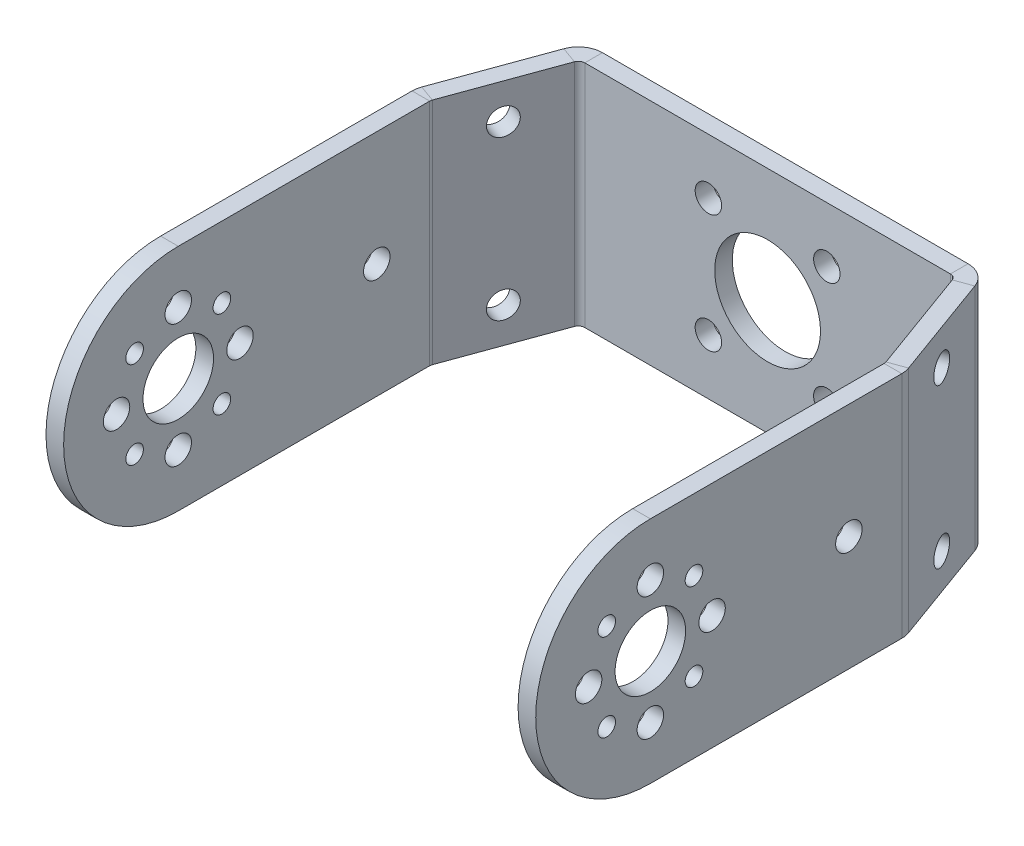
from build123d import *

# Parameters (mm, degrees)
SKETCH_1_W                       = 42.5
SKETCH_1_H                       = 26
SM_BASE_FLANGE_1_DEPTH           = 2
SM_EDGE_FLANGE_1_STRIP_CUT_DEPTH = 26
SM_EDGE_FLANGE_1_DEPTH           = 26
SM_EDGE_FLANGE_2_STRIP_CUT_DEPTH = 26
SM_EDGE_FLANGE_2_DEPTH           = 26
SM_EDGE_FLANGE_3_STRIP_CUT_DEPTH = 26
SM_EDGE_FLANGE_3_DEPTH           = 26
SM_EDGE_FLANGE_4_STRIP_CUT_DEPTH = 26
SM_EDGE_FLANGE_4_DEPTH           = 26
CUT_EXTRUDE_1_DEPTH              = 100
SKETCH_19_R                      = 1
SKETCH_19_R_2                    = 1.5
SKETCH_19_R_3                    = 4
CUT_EXTRUDE_2_DEPTH              = 100
SKETCH_20_R                      = 6
SKETCH_20_R_2                    = 1.5
CUT_EXTRUDE_3_DEPTH              = 100
SKETCH_21_R                      = 1.5
CUT_EXTRUDE_4_DEPTH              = 2
SKETCH_22_R                      = 1.5
CUT_EXTRUDE_5_DEPTH              = 2
SKETCH_23_R                      = 1.5
CUT_EXTRUDE_6_DEPTH              = 100


# Sheet-metal steps are written as plain solids
with BuildPart() as part:
    # Sketch 1 → 基体-法兰1 (new body)
    with BuildSketch(Plane.XY):
        with Locations((2.752259036, 2.278990964)):
            Rectangle(SKETCH_1_W, SKETCH_1_H)
    extrude(amount=-SM_BASE_FLANGE_1_DEPTH)

    # 边线-法兰1 strip (across the edge) → 边线-法兰1 strip cut (cut)
    with BuildSketch(Plane(origin=(24.002259036, -10.721009036, 0), x_dir=(-0.939692620785907, 0, 0.3420201433256726), z_dir=(0, 1, 0))):
        Polygon((-9.101268459, 1.184235268), (-0.199372324, -2.055789953), (0.484667962, -0.176404712), (-8.417228173, 3.06362051), align=None)
    extrude(amount=SM_EDGE_FLANGE_1_STRIP_CUT_DEPTH, mode=Mode.SUBTRACT)

    # 边线-法兰1 section (across the edge) → 边线-法兰1 (add)
    with BuildSketch(Plane(origin=(24.002259036, -10.721009036, 0), x_dir=(-0.939692620785907, 0, 0.3420201433256726), z_dir=(0, 1, 0))):
        with BuildLine():
            Line((-2, 0.515772873), (-2, 13.219584924))
            Line((-2, 13.219584924), (0, 13.219584924))
            Line((0, 13.219584924), (0, 0.515772873))
            ThreePointArc((0, 0.515772873), (0.133212604, 0.09327647), (0.484667962, -0.176404712))
            Line((0.484667962, -0.176404712), (-0.199372324, -2.055789953))
            ThreePointArc((-0.199372324, -2.055789953), (-1.505091484, -1.053876403), (-2, 0.515772873))
        make_face()
    extrude(amount=SM_EDGE_FLANGE_1_DEPTH)

    # 边线-法兰2 strip (across the edge) → 边线-法兰2 strip cut (cut)
    with BuildSketch(Plane(origin=(28.523623366, -10.721009036, 12.422346403), x_dir=(-1, 0, 0), z_dir=(0, 1, 0))):
        Polygon((-5.074988048, 8.095806265), (-1.834962826, -0.80608987), (0.044422416, -0.122049584), (-3.195602806, 8.779846552), align=None)
    extrude(amount=SM_EDGE_FLANGE_2_STRIP_CUT_DEPTH, mode=Mode.SUBTRACT)

    # 边线-法兰2 section (across the edge) → 边线-法兰2 (add)
    with BuildSketch(Plane(origin=(28.523623366, -10.721009036, 12.422346403), x_dir=(-1, 0, 0), z_dir=(0, 1, 0))):
        with BuildLine():
            Line((-2, 0.129882454), (-2, 41.647346039))
            Line((-2, 41.647346039), (0, 41.647346039))
            Line((0, 41.647346039), (0, 0.129882454))
            ThreePointArc((0, 0.129882454), (0.011190609, 0.001973206), (0.044422416, -0.122049584))
            Line((0.044422416, -0.122049584), (-1.834962826, -0.80608987))
            ThreePointArc((-1.834962826, -0.80608987), (-1.958424897, -0.345323149), (-2, 0.129882454))
        make_face()
    extrude(amount=SM_EDGE_FLANGE_2_DEPTH)

    # 边线-法兰3 strip (across the edge) → 边线-法兰3 strip cut (cut)
    with BuildSketch(Plane(origin=(-18.497740964, 15.278990964, 0), x_dir=(0.939692620785907, 0, 0.3420201433256726), z_dir=(0, -1, 0))):
        Polygon((-9.101268459, 1.184235268), (-0.199372324, -2.055789953), (0.484667962, -0.176404712), (-8.417228173, 3.06362051), align=None)
    extrude(amount=SM_EDGE_FLANGE_3_STRIP_CUT_DEPTH, mode=Mode.SUBTRACT)

    # 边线-法兰3 section (across the edge) → 边线-法兰3 (add)
    with BuildSketch(Plane(origin=(-18.497740964, 15.278990964, 0), x_dir=(0.939692620785907, 0, 0.3420201433256726), z_dir=(0, -1, 0))):
        with BuildLine():
            Line((-2, 0.515772873), (-2, 13.219584924))
            Line((-2, 13.219584924), (0, 13.219584924))
            Line((0, 13.219584924), (0, 0.515772873))
            ThreePointArc((0, 0.515772873), (0.133212604, 0.09327647), (0.484667962, -0.176404712))
            Line((0.484667962, -0.176404712), (-0.199372324, -2.055789953))
            ThreePointArc((-0.199372324, -2.055789953), (-1.505091484, -1.053876403), (-2, 0.515772873))
        make_face()
    extrude(amount=SM_EDGE_FLANGE_3_DEPTH)

    # 边线-法兰4 strip (across the edge) → 边线-法兰4 strip cut (cut)
    with BuildSketch(Plane(origin=(-23.019105294, 15.278990964, 12.422346403), x_dir=(1, 0, 0), z_dir=(0, -1, 0))):
        Polygon((-5.074988048, 8.095806265), (-1.834962826, -0.80608987), (0.044422416, -0.122049584), (-3.195602806, 8.779846552), align=None)
    extrude(amount=SM_EDGE_FLANGE_4_STRIP_CUT_DEPTH, mode=Mode.SUBTRACT)

    # 边线-法兰4 section (across the edge) → 边线-法兰4 (add)
    with BuildSketch(Plane(origin=(-23.019105294, 15.278990964, 12.422346403), x_dir=(1, 0, 0), z_dir=(0, -1, 0))):
        with BuildLine():
            Line((-2, 0.129882454), (-2, 41.647346039))
            Line((-2, 41.647346039), (0, 41.647346039))
            Line((0, 41.647346039), (0, 0.129882454))
            ThreePointArc((0, 0.129882454), (0.011190609, 0.001973206), (0.044422416, -0.122049584))
            Line((0.044422416, -0.122049584), (-1.834962826, -0.80608987))
            ThreePointArc((-1.834962826, -0.80608987), (-1.958424897, -0.345323149), (-2, 0.129882454))
        make_face()
    extrude(amount=SM_EDGE_FLANGE_4_DEPTH)

    # 草图18 → 切除-拉伸1 (cut)
    with BuildSketch(Plane(origin=(30.523623366, 0, 0), x_dir=(0, 0, -1), z_dir=(1, 0, 0))):
        with BuildLine():
            Line((-41.069692441, 15.278990964), (-54.069692441, 15.278990964))
            Line((-54.069692441, 15.278990964), (-54.069692441, 2.278990964))
            ThreePointArc((-54.069692441, 2.278990964), (-50.262080597, 11.471379119), (-41.069692441, 15.278990964))
        make_face()
        with BuildLine():
            ThreePointArc((-41.069692441, -10.721009036), (-50.262080597, -6.913397192), (-54.069692441, 2.278990964))
            Line((-54.069692441, 2.278990964), (-54.069692441, -10.721009036))
            Line((-54.069692441, -10.721009036), (-41.069692441, -10.721009036))
        make_face()
    extrude(amount=-CUT_EXTRUDE_1_DEPTH, mode=Mode.SUBTRACT)

    # 草图19 → 切除-拉伸2 (cut)
    with BuildSketch(Plane(origin=(30.523623366, 0, 0), x_dir=(0, 0, -1), z_dir=(1, 0, 0))):
        with Locations((-36.119944973, 7.228738432)):
            Circle(SKETCH_19_R)
        with Locations((-34.069692441, 2.278990964)):
            Circle(SKETCH_19_R_2)
        with Locations((-36.119944973, -2.670756504)):
            Circle(SKETCH_19_R)
        with Locations((-41.069692441, -4.721009036)):
            Circle(SKETCH_19_R_2)
        with Locations((-46.019439909, -2.670756504)):
            Circle(SKETCH_19_R)
        with Locations((-48.069692441, 2.278990964)):
            Circle(SKETCH_19_R_2)
        with Locations((-46.019439909, 7.228738432)):
            Circle(SKETCH_19_R)
        with Locations((-41.069692441, 9.278990964)):
            Circle(SKETCH_19_R_2)
        with Locations((-41.069692441, 2.278990964)):
            Circle(SKETCH_19_R_3)
    extrude(amount=-CUT_EXTRUDE_2_DEPTH, mode=Mode.SUBTRACT)

    # 草图20 → 切除-拉伸3 (cut)
    with BuildSketch(Plane.XY):
        with Locations((2.752259036, 2.278990964)):
            Circle(SKETCH_20_R)
        with Locations((9.469773457, 8.996505385)):
            Circle(SKETCH_20_R_2)
        with Locations((-3.965255385, 8.996505385)):
            Circle(SKETCH_20_R_2)
        with Locations((-3.965255385, -4.438523457)):
            Circle(SKETCH_20_R_2)
        with Locations((9.469773457, -4.438523457)):
            Circle(SKETCH_20_R_2)
    extrude(amount=-CUT_EXTRUDE_3_DEPTH, mode=Mode.SUBTRACT)

    # 草图21 → 切除-拉伸4 (cut)
    with BuildSketch(Plane(origin=(23.073913338, 0, -8.398217643), x_dir=(-0.3420201433256726, 0, -0.9396926207859071), z_dir=(0.9396926207859071, 0, -0.3420201433256726))):
        with Locations((-15.011993747, 11.278990964)):
            Circle(SKETCH_21_R)
        with Locations((-15.011993747, -6.721009036)):
            Circle(SKETCH_21_R)
    extrude(amount=-CUT_EXTRUDE_4_DEPTH, mode=Mode.SUBTRACT)

    # 草图22 → 切除-拉伸5 (cut)
    with BuildSketch(Plane(origin=(-18.213301561, 0, -6.629099636), x_dir=(-0.3420201433256726, 0, 0.9396926207859071), z_dir=(-0.9396926207859071, 0, -0.3420201433256726))):
        with Locations((13.129337687, 11.278990964)):
            Circle(SKETCH_22_R)
        with Locations((13.129337687, -6.721009036)):
            Circle(SKETCH_22_R)
    extrude(amount=-CUT_EXTRUDE_5_DEPTH, mode=Mode.SUBTRACT)

    # 草图23 → 切除-拉伸6 (cut)
    with BuildSketch(Plane.ZY.offset(25.019105294)):
        with Locations((18.552228857, 2.278990964)):
            Circle(SKETCH_23_R)
    extrude(amount=-CUT_EXTRUDE_6_DEPTH, mode=Mode.SUBTRACT)


solid = part.part
